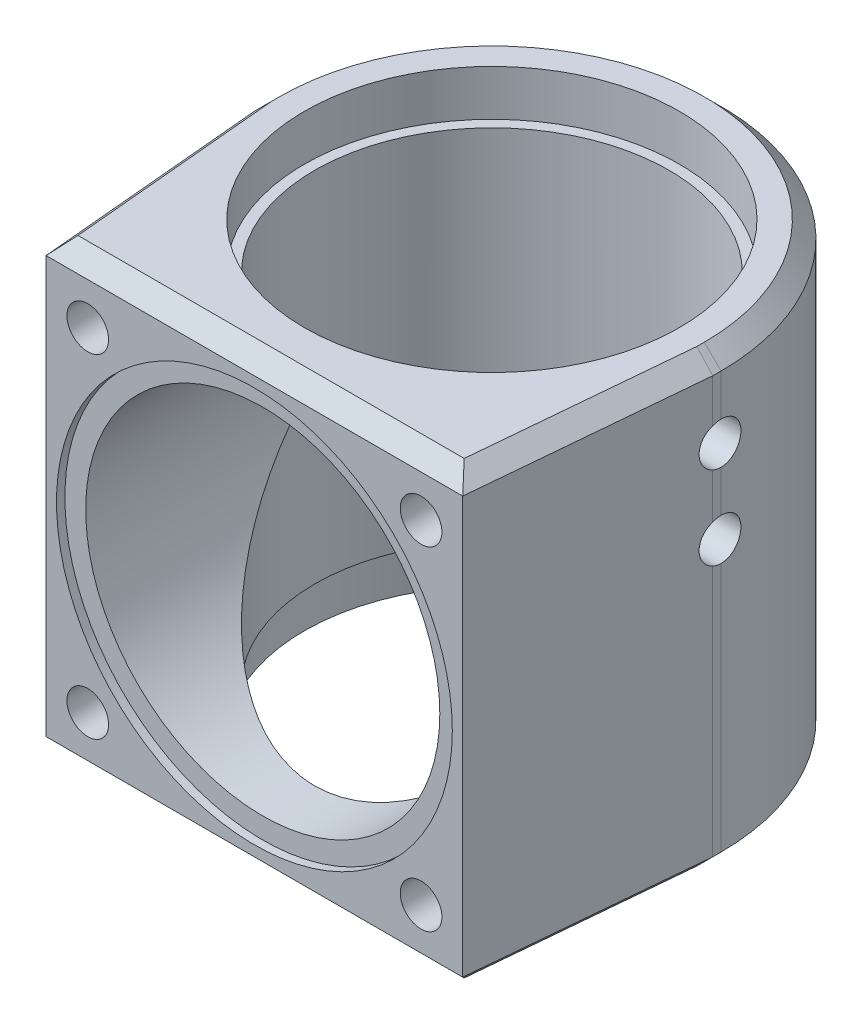
from build123d import *

# Parameters (mm, degrees)
EXTRUDE_2_DEPTH     = 108
CHAMFER_2_SIZE      = 4
SKETCH_3_R          = 42.5
CUT_EXTRUDE_1_DEPTH = 166.024240644
SKETCH_4_R          = 45
CUT_EXTRUDE_2_DEPTH = 11
CUT_EXTRUDE_START   = -11
SKETCH_5_R          = 45
CUT_EXTRUDE_3_DEPTH = 11
SKETCH_6_R          = 5
CUT_EXTRUDE_4_DEPTH = 21
SKETCH_10_R         = 47.5
CUT_EXTRUDE_5_DEPTH = 2
SKETCH_11_R         = 42.5
CUT_EXTRUDE_6_DEPTH = 55


with BuildPart() as part:
    # 草图2 → 凸台-拉伸2 (new body)
    with BuildSketch(Plane(origin=(0, 0, 0), x_dir=(1, 0, 0), z_dir=(0, 1, 0))):
        with BuildLine():
            Line((-50, 0), (50, 0))
            Line((50, 0), (55, 55))
            Line((55, 55), (55, 57))
            ThreePointArc((55, 57), (0, 112), (-55, 57))
            Line((-55, 57), (-55, 55))
            Line((-55, 55), (-50, 0))
        make_face()
    extrude(amount=EXTRUDE_2_DEPTH)

    # 倒角2
    # the kernel refuses this chamfer: 4 mm, written as the material it takes off along each edge
    with BuildSketch(Plane(origin=(-55.931316952, 108, -65.244486468), x_dir=(-0.02738295672235633, -0.9996219169112968, 0.00248935970203239), z_dir=(0.0905357460425184, 0, 0.9958932064677039)), Plane(origin=(49.068683048, 108, 10.244486468), x_dir=(0.027382956722356445, -0.9996219169112968, 0.0024893597020324005), z_dir=(0.0905357460425184, 0, -0.9958932064677039))) as chamfer_2_piece_1:
        Polygon((CHAMFER_2_SIZE * 0.999621916911, CHAMFER_2_SIZE * 0.0274958766106), (-CHAMFER_2_SIZE * 0.0274958766106, CHAMFER_2_SIZE * 0.999621916911), (0, 0), align=None)
    extrude(amount=75.80026899, mode=Mode.SUBTRACT)
    with BuildSketch(Plane(origin=(-60.286731952, 108, 0), x_dir=(0, -0.9996219169112968, 0.02749587661058639), z_dir=(1, 0, 0))) as chamfer_2_piece_2:
        Polygon((CHAMFER_2_SIZE * 0.999621916911, CHAMFER_2_SIZE * 0.0274958766106), (-CHAMFER_2_SIZE * 0.0274958766106, CHAMFER_2_SIZE * 0.999621916911), (0, 0), align=None)
    extrude(amount=120.573463904, mode=Mode.SUBTRACT)
    with BuildSketch(Plane(origin=(55, 108, -44.713268048), x_dir=(0.027495876610585647, -0.9996219169112968, 0), z_dir=(0, 0, -1)), Plane(origin=(-55, 108, -57), x_dir=(-0.027495876610585647, -0.9996219169112968, 0), z_dir=(0, 0, 1))) as chamfer_2_piece_3:
        Polygon((CHAMFER_2_SIZE * 0.999621916911, CHAMFER_2_SIZE * 0.0274958766106), (-CHAMFER_2_SIZE * 0.0274958766106, CHAMFER_2_SIZE * 0.999621916911), (0, 0), align=None)
    extrude(amount=12.286731952, mode=Mode.SUBTRACT)
    with BuildSketch(Plane(origin=(0, 108, -57), x_dir=(1, 0, 0), z_dir=(0, 0, 1))) as chamfer_2_piece_4:
        Polygon((55, -CHAMFER_2_SIZE), (55 - CHAMFER_2_SIZE, 0), (55, 0), align=None)
    revolve(axis=Axis((0, 108, -57), (0, 1, 0)), revolution_arc=180, mode=Mode.SUBTRACT)
    with BuildSketch(Plane(origin=(55, 0, -44.713268048), x_dir=(0.02749587661058563, 0.9996219169112968, 0), z_dir=(0, 0, -1)), Plane(origin=(-55, 0, -57), x_dir=(-0.02749587661058563, 0.9996219169112968, 0), z_dir=(0, 0, 1))) as chamfer_2_piece_5:
        Polygon((CHAMFER_2_SIZE * 0.999621916911, -CHAMFER_2_SIZE * 0.0274958766106), (-CHAMFER_2_SIZE * 0.0274958766106, -CHAMFER_2_SIZE * 0.999621916911), (0, 0), align=None)
    extrude(amount=12.286731952, mode=Mode.SUBTRACT)
    with BuildSketch(Plane(origin=(49.068683048, 0, 10.244486468), x_dir=(0.027382956722356428, 0.9996219169112968, 0.0024893597020323992), z_dir=(0.0905357460425184, 0, -0.9958932064677039)), Plane(origin=(-55.931316952, 0, -65.244486468), x_dir=(-0.027382956722356314, 0.9996219169112968, 0.0024893597020323884), z_dir=(0.0905357460425184, 0, 0.9958932064677039))) as chamfer_2_piece_6:
        Polygon((CHAMFER_2_SIZE * 0.999621916911, -CHAMFER_2_SIZE * 0.0274958766106), (-CHAMFER_2_SIZE * 0.0274958766106, -CHAMFER_2_SIZE * 0.999621916911), (0, 0), align=None)
    extrude(amount=75.80026899, mode=Mode.SUBTRACT)
    with BuildSketch(Plane(origin=(-60.286731952, 0, 0), x_dir=(0, 0.9996219169112968, 0.027495876610586372), z_dir=(1, 0, 0))) as chamfer_2_piece_7:
        Polygon((CHAMFER_2_SIZE * 0.999621916911, -CHAMFER_2_SIZE * 0.0274958766106), (-CHAMFER_2_SIZE * 0.0274958766106, -CHAMFER_2_SIZE * 0.999621916911), (0, 0), align=None)
    extrude(amount=120.573463904, mode=Mode.SUBTRACT)
    with BuildSketch(Plane(origin=(0, 0, -57), x_dir=(1, 0, 0), z_dir=(0, 0, 1))) as chamfer_2_piece_8:
        Polygon((55, CHAMFER_2_SIZE), (55 - CHAMFER_2_SIZE, 0), (55, 0), align=None)
    revolve(axis=Axis((0, 0, -57), (0, 1, 0)), revolution_arc=180, mode=Mode.SUBTRACT)

    # 草图3 → 切除-拉伸1 (cut, through all)
    with BuildSketch(Plane(origin=(0, 108, 0), x_dir=(1, 0, 0), z_dir=(0, 1, 0))):
        with Locations(Location((0, 57, 0), (0, 0, 270))):
            Circle(SKETCH_3_R)
    extrude(amount=-CUT_EXTRUDE_1_DEPTH, mode=Mode.SUBTRACT)

    # 草图4 → 切除-拉伸2 (cut)
    with BuildSketch(Plane(origin=(0, 108, 0), x_dir=(1, 0, 0), z_dir=(0, 1, 0))):
        with Locations(Location((0, 57, 0), (0, 0, 270))):
            Circle(SKETCH_4_R)
    extrude(amount=-CUT_EXTRUDE_2_DEPTH, mode=Mode.SUBTRACT)

    # 草图5 → 切除-拉伸3 (cut)
    with BuildSketch(Plane.XZ.offset(CUT_EXTRUDE_START)):
        with Locations(Location((0, -57, 0), (0, 0, 90))):
            Circle(SKETCH_5_R)
    extrude(amount=CUT_EXTRUDE_3_DEPTH, mode=Mode.SUBTRACT)

    # 草图6 → 切除-拉伸4 (cut)
    with BuildSketch(Plane.XY):
        with Locations((40, 94)):
            Circle(SKETCH_6_R)
        with Locations((-40, 94)):
            Circle(SKETCH_6_R)
        with Locations((-40, 14)):
            Circle(SKETCH_6_R)
        with Locations((40, 14)):
            Circle(SKETCH_6_R)
    extrude(amount=-CUT_EXTRUDE_4_DEPTH, mode=Mode.SUBTRACT)

    # 草图8 → 切除-旋转2 (revolve, cut)
    with BuildSketch(Plane(origin=(0, 89, 0), x_dir=(1, 0, 0), z_dir=(0, 1, 0)), mode=Mode.PRIVATE) as cut_revolve_2_sk:
        Polygon((55, 57), (25, 57), (25, 55), (45, 55), (45, 52), (55, 52), align=None)
    revolve(cut_revolve_2_sk.sketch.rotate(Axis((51, 89, -57), (-1, 0, 0)), 180), axis=Axis((51, 89, -57), (-1, 0, 0)), mode=Mode.SUBTRACT)

    # 草图9 → 切除-旋转3 (revolve, cut)
    with BuildSketch(Plane(origin=(0, 69, 0), x_dir=(1, 0, 0), z_dir=(0, 1, 0)), mode=Mode.PRIVATE) as cut_revolve_3_sk:
        Polygon((55, 57), (25, 57), (25, 55), (45, 55), (45, 52), (55, 52), align=None)
    revolve(cut_revolve_3_sk.sketch.rotate(Axis((55, 69, -57), (-1, 0, 0)), 180), axis=Axis((55, 69, -57), (-1, 0, 0)), mode=Mode.SUBTRACT)

    # 草图10 → 切除-拉伸5 (cut)
    with BuildSketch(Plane.XY):
        with Locations((0, 54)):
            Circle(SKETCH_10_R)
    extrude(amount=-CUT_EXTRUDE_5_DEPTH, mode=Mode.SUBTRACT)

    # 草图11 → 切除-拉伸6 (cut)
    with BuildSketch(Plane.XY.offset(-2)):
        with Locations((0, 54)):
            Circle(SKETCH_11_R)
    extrude(amount=-CUT_EXTRUDE_6_DEPTH, mode=Mode.SUBTRACT)


solid = part.part
